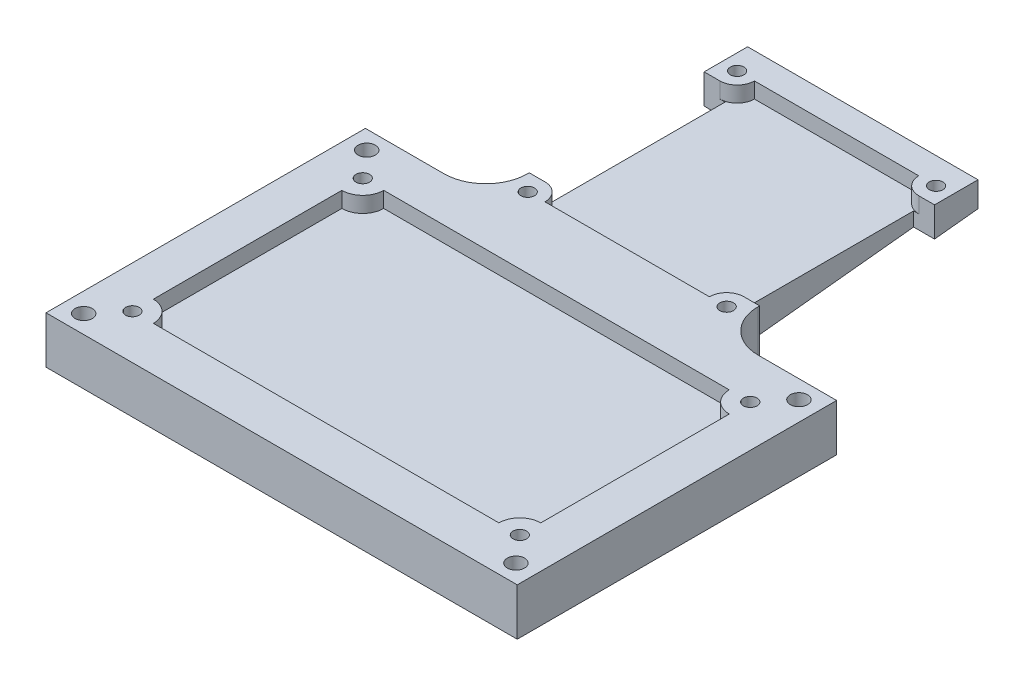
from build123d import *

# Parameters (mm, degrees)
SKETCH1_R           = 1.65
BOSS_EXTRUDE1_DEPTH = 9
CHAMFER1_SIZE       = 40
CHAMFER1_SIZE2      = 4.204169411
SKETCH2_R           = 1.3
CUT_EXTRUDE1_DEPTH  = 144.185194765
SKETCH3_R           = 1.3
CUT_EXTRUDE2_DEPTH  = 144.185194765
CUT_EXTRUDE3_DEPTH  = 3
CUT_EXTRUDE4_DEPTH  = 3
SKETCH6_W           = 4
SKETCH6_H           = 33.4
CUT_EXTRUDE5_DEPTH  = 144.185194765


with BuildPart() as part:
    # Sketch1 → Boss-Extrude1 (new body)
    with BuildSketch(Plane(origin=(0, 0, 0), x_dir=(1, 0, 0), z_dir=(0, 1, 0))):
        with BuildLine():
            Line((0, 0), (90, 0))
            Line((90, 0), (90, 61))
            Line((90, 61), (75, 61))
            ThreePointArc((75, 61), (69.343145751, 63.343145751), (67, 69))
            Line((67, 69), (67, 111))
            Line((67, 111), (23, 111))
            Line((23, 111), (23, 69))
            ThreePointArc((23, 69), (20.656854249, 63.343145751), (15, 61))
            Line((15, 61), (0, 61))
            Line((0, 61), (0, 0))
        make_face()
        with Locations((3.725, 57.525)):
            Circle(SKETCH1_R, mode=Mode.SUBTRACT)
        with Locations((86.275, 57.525)):
            Circle(SKETCH1_R, mode=Mode.SUBTRACT)
        with Locations((86.275, 3.475)):
            Circle(SKETCH1_R, mode=Mode.SUBTRACT)
        with Locations((3.725, 3.475)):
            Circle(SKETCH1_R, mode=Mode.SUBTRACT)
    extrude(amount=BOSS_EXTRUDE1_DEPTH)

    # Chamfer1
    chamfer1_edges = [part.edges().sort_by_distance(p)[0] for p in [
        (45, 0, -111),
    ]]
    chamfer1_side = [part.faces().sort_by_distance(p)[0] for p in [
        (45, 0, -46.507129493),
    ]]
    chamfer(chamfer1_edges, length=CHAMFER1_SIZE, length2=CHAMFER1_SIZE2, reference=chamfer1_side[0])

    # Sketch2 → Cut-Extrude1 (cut, through all)
    with BuildSketch(Plane(origin=(0, 9, 0), x_dir=(1, 0, 0), z_dir=(0, 1, 0))):
        with Locations((8, 52.5)):
            Circle(SKETCH2_R)
        with Locations((8, 8.5)):
            Circle(SKETCH2_R)
        with Locations((82, 52.5)):
            Circle(SKETCH2_R)
        with Locations((82, 8.5)):
            Circle(SKETCH2_R)
    extrude(amount=-CUT_EXTRUDE1_DEPTH, mode=Mode.SUBTRACT)

    # Sketch3 → Cut-Extrude2 (cut, through all)
    with BuildSketch(Plane(origin=(0, 9, 0), x_dir=(1, 0, 0), z_dir=(0, 1, 0))):
        with Locations((26, 106)):
            Circle(SKETCH3_R)
        with Locations((64, 106)):
            Circle(SKETCH3_R)
        with Locations((26, 66)):
            Circle(SKETCH3_R)
        with Locations((64, 66)):
            Circle(SKETCH3_R)
    extrude(amount=-CUT_EXTRUDE2_DEPTH, mode=Mode.SUBTRACT)

    # Sketch4 → Cut-Extrude3 (cut)
    with BuildSketch(Plane(origin=(0, 9, 0), x_dir=(1, 0, 0), z_dir=(0, 1, 0))):
        with BuildLine():
            Line((12, 52.5), (78, 52.5))
            ThreePointArc((78, 52.5), (79.171572875, 49.671572875), (82, 48.5))
            Line((82, 48.5), (82, 12.5))
            ThreePointArc((82, 12.5), (79.171572875, 11.328427125), (78, 8.5))
            Line((78, 8.5), (12, 8.5))
            ThreePointArc((12, 8.5), (10.828427125, 11.328427125), (8, 12.5))
            Line((8, 12.5), (8, 48.5))
            ThreePointArc((8, 48.5), (10.828427125, 49.671572875), (12, 52.5))
        make_face()
    extrude(amount=-CUT_EXTRUDE3_DEPTH, mode=Mode.SUBTRACT)

    # Sketch5 → Cut-Extrude4 (cut)
    with BuildSketch(Plane(origin=(0, 9, 0), x_dir=(1, 0, 0), z_dir=(0, 1, 0))):
        with BuildLine():
            Line((29.3, 106), (60.7, 106))
            ThreePointArc((60.7, 106), (61.666547622, 103.666547622), (64, 102.7))
            Line((64, 102.7), (64, 69.3))
            ThreePointArc((64, 69.3), (61.666547622, 68.333452378), (60.7, 66))
            Line((60.7, 66), (29.3, 66))
            ThreePointArc((29.3, 66), (28.333452378, 68.333452378), (26, 69.3))
            Line((26, 69.3), (26, 102.7))
            ThreePointArc((26, 102.7), (28.333452378, 103.666547622), (29.3, 106))
        make_face()
    extrude(amount=-CUT_EXTRUDE4_DEPTH, mode=Mode.SUBTRACT)

    # Sketch6 → Cut-Extrude5 (cut, through all)
    with BuildSketch(Plane(origin=(0, 9, 0), x_dir=(1, 0, 0), z_dir=(0, 1, 0))):
        with Locations((25, 86)):
            Rectangle(SKETCH6_W, SKETCH6_H)
        with Locations((65, 86)):
            Rectangle(SKETCH6_W, SKETCH6_H)
    extrude(amount=-CUT_EXTRUDE5_DEPTH, mode=Mode.SUBTRACT)


solid = part.part
